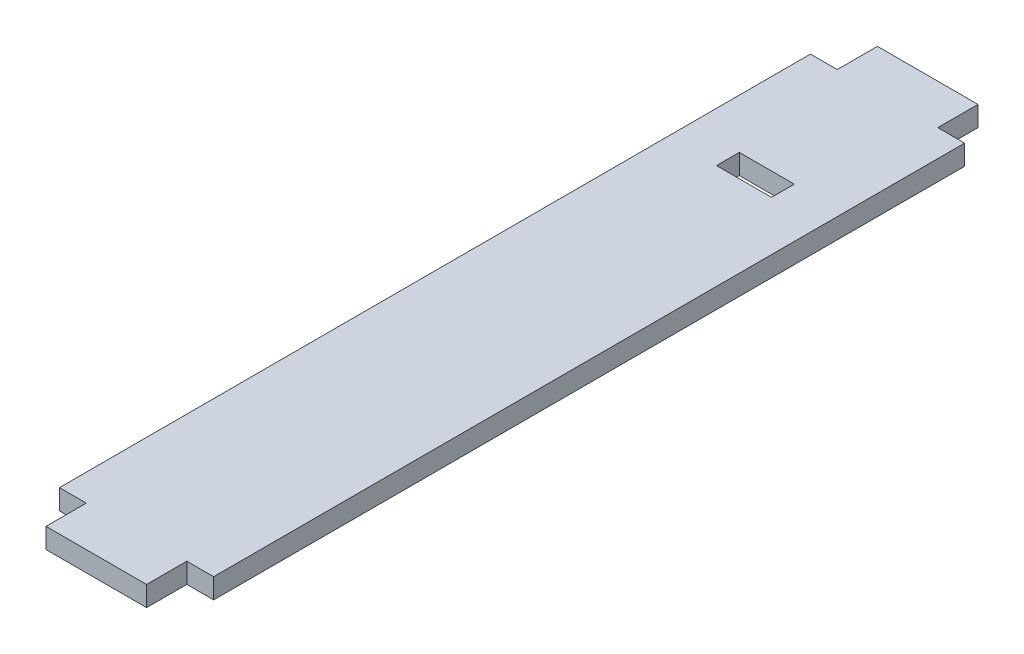
from build123d import *

# Parameters (mm, degrees)
SKETCH1_W           = 4.1
SKETCH1_H           = 1.7
BOSS_EXTRUDE1_DEPTH = 1.5


with BuildPart() as part:
    # Sketch1 → Boss-Extrude1 (new body)
    with BuildSketch(Plane(origin=(0, 0, 0), x_dir=(1, 0, 0), z_dir=(0, 1, 0))):
        Polygon((3.75, 28), (5.75, 28), (5.75, -12.4), (5.75, -14.1), (5.75, -28), (3.75, -28), (3.75, -31), (-3.75, -31), (-3.75, -28), (-5.75, -28), (-5.75, -16.6), (-5.75, -14.9), (-5.75, 28), (-3.75, 28), (-3.75, 31), (3.75, 31), align=None)
        with Locations((0, 18.15)):
            Rectangle(SKETCH1_W, SKETCH1_H, mode=Mode.SUBTRACT)
    extrude(amount=BOSS_EXTRUDE1_DEPTH)


solid = part.part
